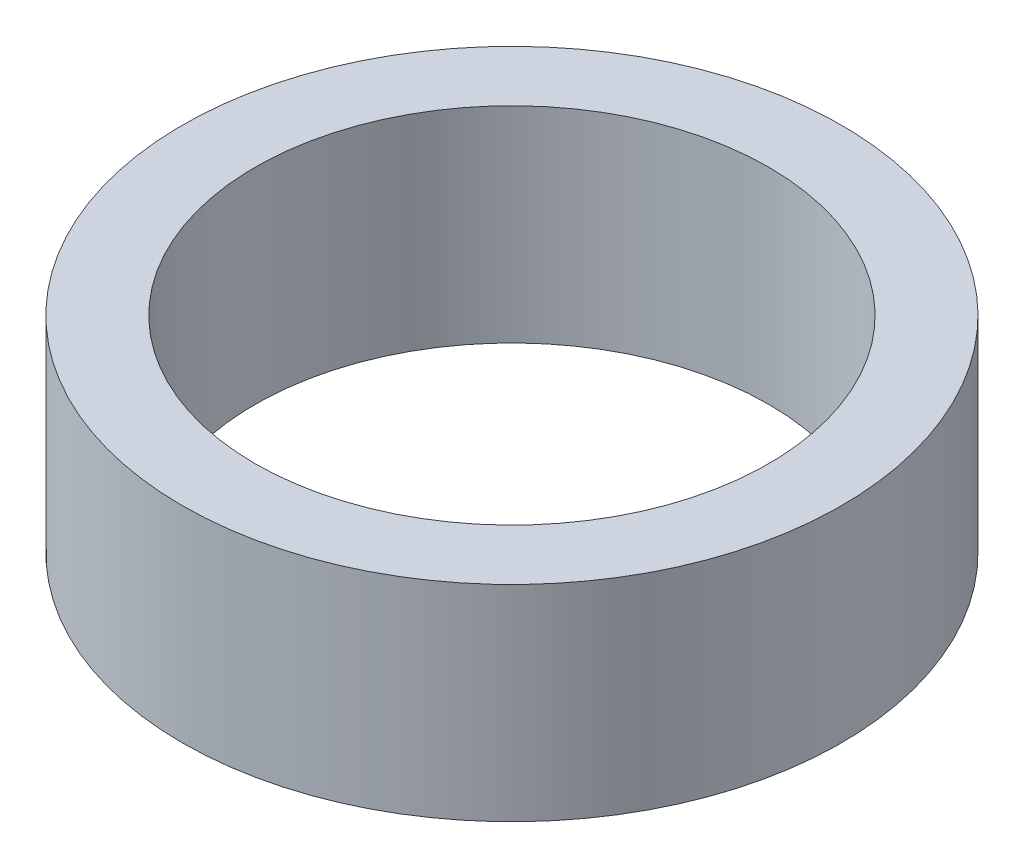
from build123d import *

# Parameters (mm, degrees)
ESQUISSE1_R        = 3.85
ESQUISSE1_R_2      = 3
BOSS_EXTRU_1_DEPTH = 2.4


with BuildPart() as part:
    # Esquisse1 → Boss.-Extru.1 (new body)
    with BuildSketch(Plane(origin=(0, 0, 0), x_dir=(1, 0, 0), z_dir=(0, 1, 0))):
        Circle(ESQUISSE1_R)
        Circle(ESQUISSE1_R_2, mode=Mode.SUBTRACT)
    extrude(amount=BOSS_EXTRU_1_DEPTH)


solid = part.part
